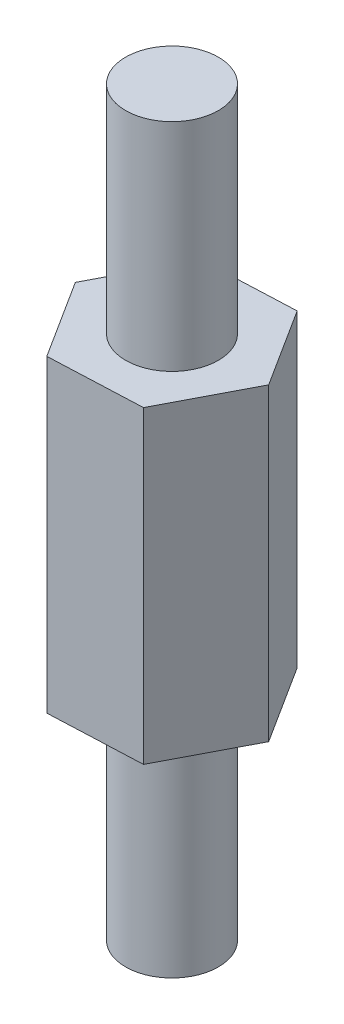
from build123d import *

# Parameters (mm, degrees)
BOSS_EXTRUDE1_DEPTH = 10
SKETCH4_R           = 1.5
BOSS_EXTRUDE2_DEPTH = 7
BOSS_EXTRUDE3_START = 7
SKETCH5_R           = 1.5
BOSS_EXTRUDE3_DEPTH = 7


with BuildPart() as part:
    # Sketch3 → Boss-Extrude1 (new body)
    with BuildSketch(Plane(origin=(0, 0, 0), x_dir=(1, 0, 0), z_dir=(0, 1, 0))):
        Polygon((1.388964752, 2.662182442), (-1.611035248, 2.533969981), (-3, -0.12821246), (-1.388964752, -2.662182442), (1.611035248, -2.533969981), (3, 0.12821246), align=None)
    extrude(amount=BOSS_EXTRUDE1_DEPTH)

    # Sketch4 → Boss-Extrude2 (add)
    with BuildSketch(Plane(origin=(0, 10, 0), x_dir=(1, 0, 0), z_dir=(0, 1, 0))):
        Circle(SKETCH4_R)
    extrude(amount=BOSS_EXTRUDE2_DEPTH)

    # Sketch5 → Boss-Extrude3 (add)
    with BuildSketch(Plane.XZ.offset(BOSS_EXTRUDE3_START)):
        Circle(SKETCH5_R)
    extrude(amount=-BOSS_EXTRUDE3_DEPTH)


solid = part.part
